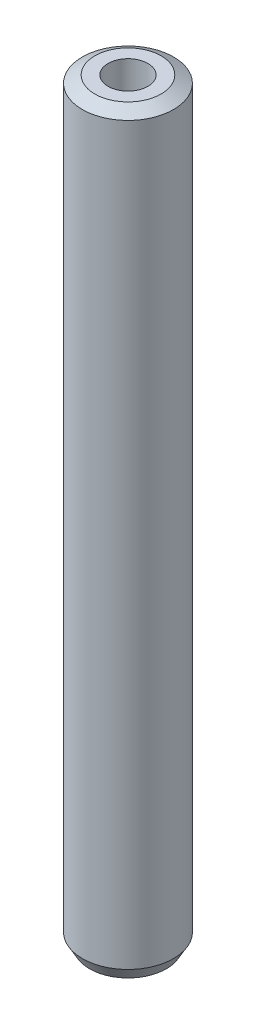
from build123d import *
from OCP.BRepFilletAPI import BRepFilletAPI_MakeChamfer

# Parameters (mm, degrees)
SKETCH1_R           = 27.5
BOSS_EXTRUDE1_DEPTH = 455.307275643
SKETCH2_R           = 12.003393073
CUT_EXTRUDE1_DEPTH  = 457.965223243
CHAMFER1_SIZE       = 4.346155916
CHAMFER1_SIZE2      = 7.527762863


with BuildPart() as part:
    # Sketch1 → Boss-Extrude1 (new body)
    with BuildSketch(Plane(origin=(0, 0, 0), x_dir=(1, 0, 0), z_dir=(0, 1, 0))):
        Circle(SKETCH1_R)
    extrude(amount=BOSS_EXTRUDE1_DEPTH)

    # Sketch2 → Cut-Extrude1 (cut, through all)
    with BuildSketch(Plane(origin=(0, 0, 0), x_dir=(1, 0, 0), z_dir=(0, 1, 0))):
        Circle(SKETCH2_R)
    extrude(amount=CUT_EXTRUDE1_DEPTH, mode=Mode.SUBTRACT)

    # Chamfer1: one chamfer whose edges measure the first distance from different faces: ONE call of the kernel's chamfer builder (chamfer() names one face for all edges)
    chamfer1_edges_1 = [part.edges().sort_by_distance(p)[0] for p in [
        (-27.5, 455.307275643, 0),
    ]]
    chamfer1_side_1 = [part.faces().sort_by_distance(p)[0] for p in [
        (-27.5, 227.653637821, 0),
    ]]
    chamfer1_edges_2 = [part.edges().sort_by_distance(p)[0] for p in [
        (-27.5, 0, 0),
    ]]
    chamfer1_side_2 = [part.faces().sort_by_distance(p)[0] for p in [
        (-26.722182541, 0, 0),
    ]]
    chamfer1 = BRepFilletAPI_MakeChamfer(part.part.solid().wrapped)
    for e in chamfer1_edges_1:
        chamfer1.Add(CHAMFER1_SIZE, CHAMFER1_SIZE2, e.wrapped, chamfer1_side_1[0].wrapped)  # the first distance lies on this face
    for e in chamfer1_edges_2:
        chamfer1.Add(CHAMFER1_SIZE, CHAMFER1_SIZE2, e.wrapped, chamfer1_side_2[0].wrapped)  # the first distance lies on this face
    add(Compound.cast(chamfer1.Shape()), mode=Mode.REPLACE)


solid = part.part
